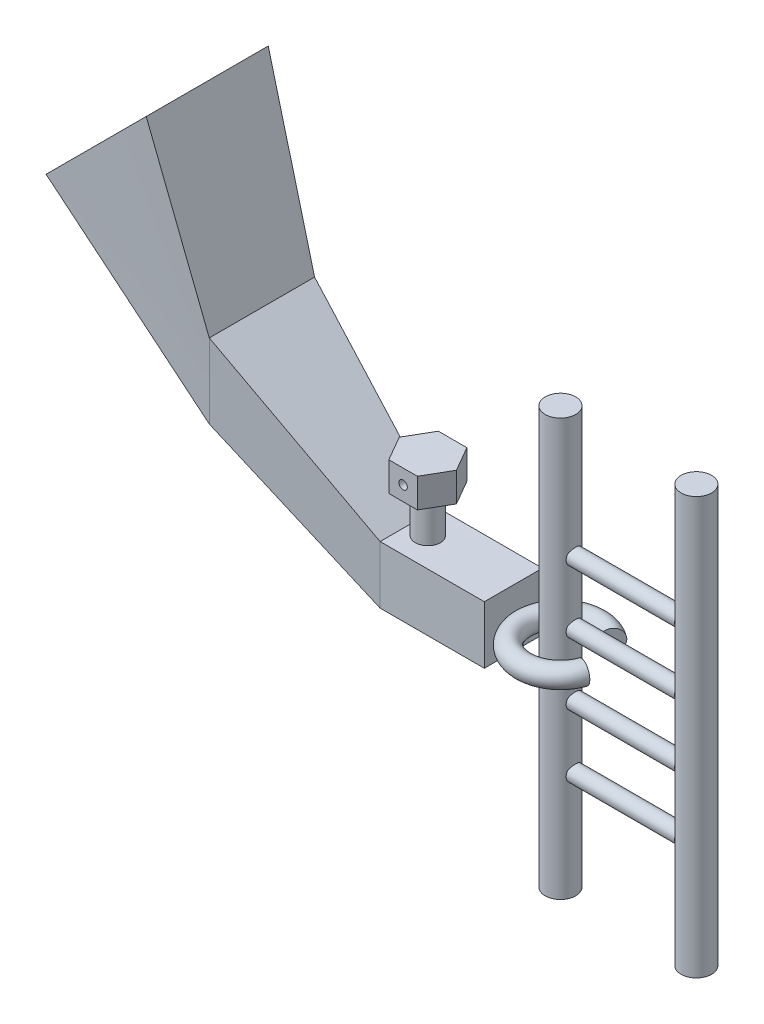
from build123d import *

# Parameters (mm, degrees)
SKETCH_1_R            = 3.659721806
EXTRUDE_1_DEPTH       = 100
SKETCH_2_R            = 1.923374245
EXTRUDE_2_DEPTH       = 13
MOVE_START            = -13
MOVE_BODY_4_OUTLINE_R = 1.923374245
MOVE_BODY_4_DEPTH     = 26
SWEEP_4_PROFILE_R     = 2.5
SKETCH_28_W           = 13.938552386
SKETCH_28_H           = 13.832988403
EXTRUDE_3_DEPTH       = 25
SKETCH_31_R           = 2.995033529
EXTRUDE_4_DEPTH       = 10
EXTRUDE_5_DEPTH       = 7
SKETCH_33_R           = 1.00927381
CUT_EXTRUDE_1_DEPTH   = 135.423062289


# Read off the part's stored shape, not the designer's step: 实体-移动/复制4
with BuildPart() as part:
    # 草图1 → 凸台-拉伸1 (new body)
    with BuildSketch(Plane(origin=(0, 0, 0), x_dir=(1, 0, 0), z_dir=(0, 1, 0))):
        with Locations(Location((-16.298188438, 0, 0), (0, 0, 270))):
            Circle(SKETCH_1_R)
    extrude(amount=EXTRUDE_1_DEPTH)


with BuildPart() as body_2:
    # 镜向5: mirrored copy
    add(part.part.mirror(Plane(origin=(0, 0, 0), x_dir=(0, 0, 1), z_dir=(1, 0, 0))))


with BuildPart() as body_3:
    # 草图2 → 凸台-拉伸2 (new, symmetric)
    with BuildSketch(Plane(origin=(0, 0, 0), x_dir=(0, 0, -1), z_dir=(1, 0, 0))):
        with Locations(Location((0, 70.49857282, 0), (0, 0, 180))):
            Circle(SKETCH_2_R)
    extrude(amount=EXTRUDE_2_DEPTH, both=True)


with BuildPart() as body_4:
    # Move Body 3: copy of body 3
    add(body_3.part.moved(Location((0, -15, 0))))


with BuildPart() as body_5:
    # Move Body 4 outline → Move Body 4 (new body)
    with BuildSketch(Plane.YZ.offset(MOVE_START)):
        with Locations((40.49857282, 0)):
            Circle(MOVE_BODY_4_OUTLINE_R)
        with Locations((25.49857282, 0)):
            Circle(MOVE_BODY_4_OUTLINE_R)
    extrude(amount=MOVE_BODY_4_DEPTH)


with BuildPart() as body_6:
    # 扫描4: sweep along a path in 草图21
    with BuildLine(Plane(origin=(0, 0, 0), x_dir=(1, 0, 0), z_dir=(0, 1, 0))) as sweep_4_path:
        ThreePointArc((-11.004253152, 7.133782197), (-24.784747158, -2.625818033), (-7.900493606, -2.89746799))
    # 扫描4 profile (on start of the path) → 扫描4 (sweep)
    with BuildSketch(Plane(origin=(-11.004253152, 0, -7.133782197), x_dir=(0.5959288997346694, 0, -0.8030372011688042), z_dir=(-0.8030372011688042, 0, -0.5959288997346694))):
        Circle(SWEEP_4_PROFILE_R)
    sweep(path=sweep_4_path.line)


with BuildPart() as body_6_1:
    # Move Body 5: moved
    add(body_6.part.moved(Location((0, 50.332827788, 0))))

    # 草图28 → 凸台-拉伸3 (add)
    with BuildSketch(Plane(origin=(-27.583086443, 0, 0), x_dir=(0, 0, -1), z_dir=(1, 0, 0))):
        with Locations((0, 50.200659589)):
            Rectangle(SKETCH_28_W, SKETCH_28_H)
    extrude(amount=-EXTRUDE_3_DEPTH)

    # 草图30 → 放样2 section 0
    with BuildSketch(Plane.ZY.offset(52.583086443)):
        with BuildLine():
            Line((-6.969276193, 43.284165387), (6.969276193, 43.284165387))
            Line((6.969276193, 43.284165387), (6.969276193, 57.11715379))
            Line((6.969276193, 57.11715379), (-6.969276193, 57.11715379))
            Line((-6.969276193, 57.11715379), (-6.969276193, 43.284165387))
        make_face()
    # 草图29 → 放样2 section 1
    with BuildSketch(Plane(origin=(-87.890844006, 0, 0), x_dir=(0, 0, -1), z_dir=(1, 0, 0))):
        with BuildLine():
            Line((12.629992537, 84.590242061), (-12.629992537, 84.590242061))
            Line((-12.629992537, 84.590242061), (-12.629992537, 66.703532711))
            Line((-12.629992537, 66.703532711), (12.629992537, 66.703532711))
            Line((12.629992537, 66.703532711), (12.629992537, 84.590242061))
        make_face()
    loft()

    # 草图31 → 凸台-拉伸4 (add)
    with BuildSketch(Plane(origin=(0, 57.11715379, 0), x_dir=(1, 0, 0), z_dir=(0, 1, 0))):
        with Locations(Location((-48.098235143, 0, 0), (0, 0, 270))):
            Circle(SKETCH_31_R)
    extrude(amount=EXTRUDE_4_DEPTH)

    # 草图32 → 凸台-拉伸5 (add)
    with BuildSketch(Plane(origin=(0, 67.11715379, 0), x_dir=(1, 0, 0), z_dir=(0, 1, 0))):
        Polygon((-41.241970146, 0), (-44.670102644, 5.937699663), (-51.526367642, 5.937699663), (-54.95450014, 0), (-51.526367642, -5.937699663), (-44.670102644, -5.937699663), align=None)
    extrude(amount=EXTRUDE_5_DEPTH)

    # 草图33 → 切除-拉伸1 (cut, through all)
    with BuildSketch(Plane.XY.offset(5.937699663)):
        with Locations((-48.098235143, 70.61715379)):
            Circle(SKETCH_33_R)
    extrude(amount=-CUT_EXTRUDE_1_DEPTH, mode=Mode.SUBTRACT)

    # 草图36 → 放样7 section 0
    with BuildSketch(Plane(origin=(-113.021219596, 113.021219596, 0), x_dir=(0.7071067811865477, 0.7071067811865475, 0), z_dir=(-0.7071067811865475, 0.7071067811865477, 0))):
        with BuildLine():
            Line((-16.980025472, 14.6341009), (16.980025472, 14.6341009))
            Line((16.980025472, 14.6341009), (16.980025472, -14.6341009))
            Line((16.980025472, -14.6341009), (-16.980025472, -14.6341009))
            Line((-16.980025472, -14.6341009), (-16.980025472, 14.6341009))
        make_face()
    # 草图35 → 放样7 section 1
    with BuildSketch(Plane.ZY.offset(87.890844006)):
        with BuildLine():
            Line((-12.629992537, 66.703532711), (12.629992537, 66.703532711))
            Line((12.629992537, 66.703532711), (12.629992537, 84.590242061))
            Line((12.629992537, 84.590242061), (-12.629992537, 84.590242061))
            Line((-12.629992537, 84.590242061), (-12.629992537, 66.703532711))
        make_face()
    loft()


solid = Compound([part.part, body_2.part, body_3.part, body_4.part, body_5.part, body_6_1.part])
